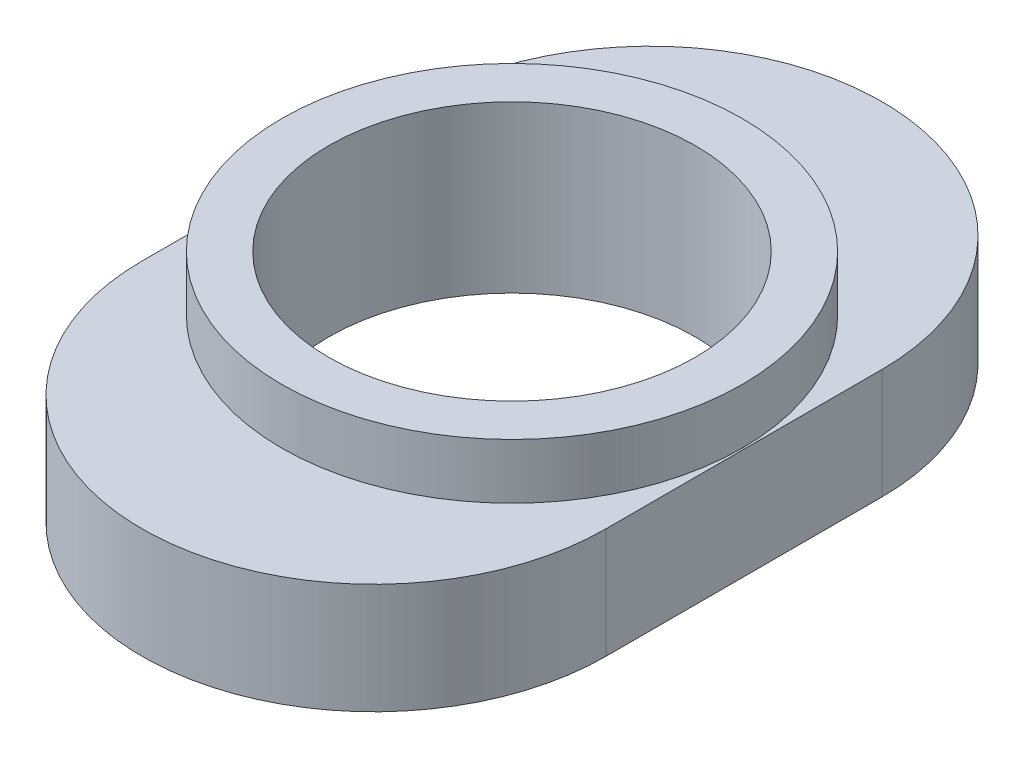
from build123d import *

# Parameters (mm, degrees)
BOSS_EXTRUDE1_DEPTH = 2.54
SKETCH2_R           = 4.2164
CUT_EXTRUDE1_DEPTH  = 2.54
EXTRUDE_THIN1_START = 1.27
SKETCH3_R           = 5.2959
SKETCH3_R_2         = 4.2164
EXTRUDE_THIN1_DEPTH = 1.27


with BuildPart() as part:
    # Sketch1 → Boss-Extrude1 (new body)
    with BuildSketch(Plane(origin=(0, 0, 0), x_dir=(1, 0, 0), z_dir=(0, 1, 0))):
        with BuildLine():
            Line((5.334, 3.175), (5.334, -3.175))
            ThreePointArc((5.334, -3.175), (0, -8.509), (-5.334, -3.175))
            Line((-5.334, -3.175), (-5.334, 3.175))
            ThreePointArc((-5.334, 3.175), (0, 8.509), (5.334, 3.175))
        make_face()
    extrude(amount=BOSS_EXTRUDE1_DEPTH)

    # Sketch2 → Cut-Extrude1 (cut)
    with BuildSketch(Plane(origin=(0, 2.54, 0), x_dir=(1, 0, 0), z_dir=(0, 1, 0))):
        Circle(SKETCH2_R)
    extrude(amount=-CUT_EXTRUDE1_DEPTH, mode=Mode.SUBTRACT)

    # Sketch3 → Extrude-Thin1 (add)
    with BuildSketch(Plane(origin=(0, 2.54, 0), x_dir=(1, 0, 0), z_dir=(0, 1, 0)).offset(EXTRUDE_THIN1_START)):
        Circle(SKETCH3_R)
        Circle(SKETCH3_R_2, mode=Mode.SUBTRACT)
    extrude(amount=-EXTRUDE_THIN1_DEPTH)


solid = part.part
